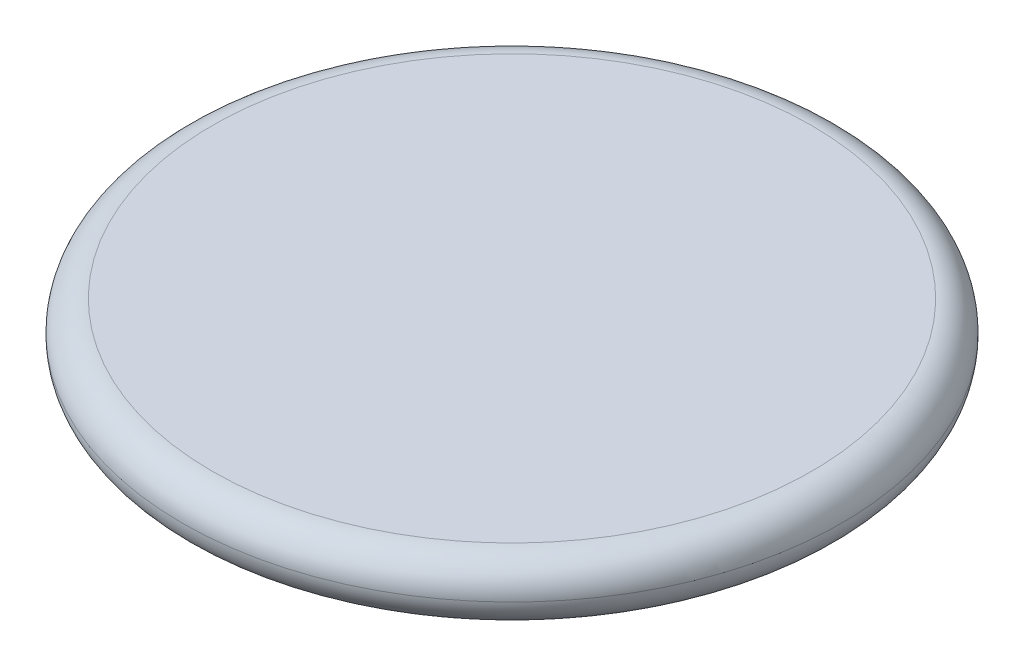
from build123d import *

# Parameters (mm, degrees)
BOSS_EXTRUDE1_DEPTH      = 20
BOSS_EXTRUDE1_DEPTH_BACK = 20
SKETCH2_R                = 220
FILLET1_R                = 20


with BuildPart() as part:
    # Sketch2 → Boss-Extrude1 (new, two sides: drawn at the far end of the back side and taken through both)
    with BuildSketch(Plane(origin=(0, 0, 0), x_dir=(1, 0, 0), z_dir=(0, 1, 0)).offset(-BOSS_EXTRUDE1_DEPTH_BACK)):
        with Locations(Location((0, 0, 0), (0, 0, 270))):
            Circle(SKETCH2_R)
    extrude(amount=BOSS_EXTRUDE1_DEPTH + BOSS_EXTRUDE1_DEPTH_BACK)

    # Fillet1
    fillet1_edges = [part.edges().sort_by_distance(p)[0] for p in [
        (0, -20, -220),
        (0, 20, -220),
    ]]
    fillet(fillet1_edges, radius=FILLET1_R - 0.0001)  # a hair under: the kernel refuses the full size


solid = part.part
